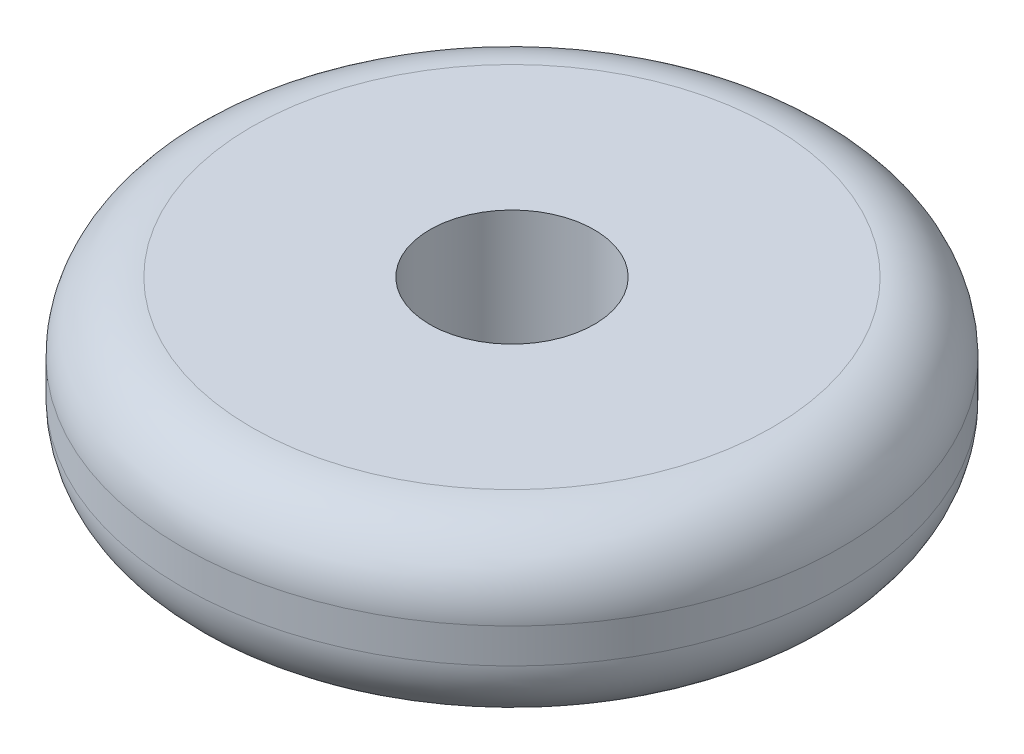
from build123d import *

# Parameters (mm, degrees)
SKETCH1_R           = 19.05
SKETCH1_R_2         = 4.75
BOSS_EXTRUDE1_DEPTH = 10
FILLET1_R           = 4


with BuildPart() as part:
    # Sketch1 → Boss-Extrude1 (new body)
    with BuildSketch(Plane(origin=(0, 0, 0), x_dir=(1, 0, 0), z_dir=(0, 1, 0))):
        Circle(SKETCH1_R)
        Circle(SKETCH1_R_2, mode=Mode.SUBTRACT)
    extrude(amount=BOSS_EXTRUDE1_DEPTH)

    # Fillet1
    fillet1_edges = [part.edges().sort_by_distance(p)[0] for p in [
        (-19.05, 0, 0),
        (-19.05, 10, 0),
    ]]
    fillet(fillet1_edges, radius=FILLET1_R)


solid = part.part
